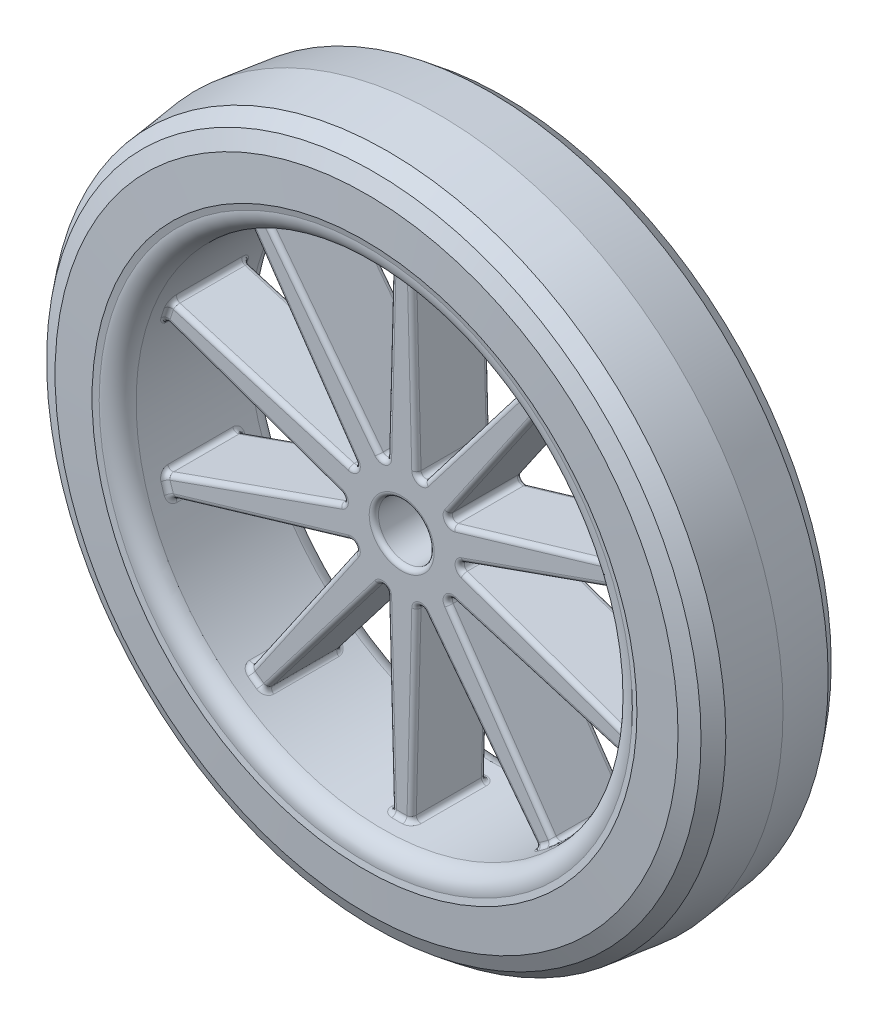
from build123d import *

# Parameters (mm, degrees)
BOSS_EXTRUDE4_DEPTH = 4
CIRPATTERN39_COUNT  = 10
FILLET4_R           = 0.5
SKETCH11_R          = 2.994477507
CUT_EXTRUDE1_DEPTH  = 10
FILLET3_R           = 0.5


# Read off the part's stored shape, not the designer's step: Revolve-Thin1
with BuildPart() as part:
    # Revolve-Thin1 outline → Revolve-Thin1 (revolve)
    with BuildSketch(Plane.XZ):
        with BuildLine():
            Line((26.5, -4.79589568), (26.5, -10.850265377))
            ThreePointArc((26.5, -10.850265377), (27.207907375, -12.198941087), (28.660266116, -12.657976066))
            Line((28.660266116, -12.657976066), (29.290683902, -12.79589568))
            ThreePointArc((29.290683902, -12.79589568), (29.151536285, -12.091168401), (28.575838837, -11.661546422))
            ThreePointArc((28.575838837, -11.661546422), (27.864520083, -11.444223367), (27.5, -10.79589568))
            Line((27.5, -10.79589568), (27.5, -4.79589568))
            Line((27.5, -4.79589568), (26.5, -4.79589568))
        make_face()
    revolve(axis=Axis((0, 0, 0), (0, 0, 1)))

    # Sketch9 → Boss-Extrude4 (add)
    with BuildSketch(Plane.XY.offset(-4.79589568)):
        Polygon((1.75, 0), (1.042980118, 27), (-1.042980118, 27), (-1.75, 0), align=None)
    extrude(amount=-BOSS_EXTRUDE4_DEPTH)

    # CirPattern39: part ×10 about axis
    cirpattern39_axis = Axis((0, 0, 0), (0, 0, 1))


with BuildPart() as part_1:
    add(part.part)
    for i in range(1, CIRPATTERN39_COUNT):
        add(part.part.rotate(cirpattern39_axis, i * 360 / CIRPATTERN39_COUNT))

    # Fillet4
    fillet4_edges = [part_1.edges().sort_by_distance(p)[0] for p in [
        (-4.239860712, 3.08043912, -6.79589568),
        (-5.240756055, 0, -6.79589568),
        (-4.239860712, -3.08043912, -6.79589568),
        (-1.619482684, -4.984255196, -6.79589568),
        (1.619482684, -4.984255196, -6.79589568),
        (4.239860712, -3.08043912, -6.79589568),
        (5.240756055, 0, -6.79589568),
        (4.239860712, 3.08043912, -6.79589568),
        (-1.619482684, 4.984255196, -6.79589568),
        (1.619482684, 4.984255196, -6.79589568),
    ]]
    fillet(fillet4_edges, radius=FILLET4_R)

    # Mirror4 2: part across plane


with BuildPart() as body_2:
    # Sketch10 → Revolve1 (revolve)
    with BuildSketch(Plane(origin=(0, 0, 0), x_dir=(0, 0, -1), z_dir=(1, 0, 0)), mode=Mode.PRIVATE) as revolve1_sk:
        Polygon((4.79589568, 27.5), (4.79589568, 37), (10.299774936, 36.34977124), (11.795301085, 35.179359471), (12.575575597, 33.488764695), (12.79589568, 29.290683902), align=None)
    revolve(revolve1_sk.sketch.rotate(Axis((0, 0, -25.261416216), (0, 0, 1)), 270), axis=Axis((0, 0, -25.261416216), (0, 0, 1)))

    # Mirror4: body 2 across plane


with BuildPart() as body_2_1:
    add(body_2.part)
    add(body_2.part.mirror(Plane(origin=(0, 27.5, -4.79589568), x_dir=(1, 0, 0), z_dir=(0, 0, -1))))


with BuildPart() as part_2:
    add(part_1.part)
    add(part_1.part.mirror(Plane(origin=(0, 27.5, -4.79589568), x_dir=(1, 0, 0), z_dir=(0, 0, -1))))

    # Sketch11 → Cut-Extrude1 (cut)
    with BuildSketch(Plane(origin=(0, 0, -8.79589568), x_dir=(-1, 0, 0), z_dir=(0, 0, -1))):
        Circle(SKETCH11_R)
    extrude(amount=-CUT_EXTRUDE1_DEPTH, mode=Mode.SUBTRACT)

    # Fillet3
    fillet3_edges = [part_2.edges().sort_by_distance(p)[0] for p in [
        (14.709094931, 22.042969997, -2.79589568),
        (0, 26.5, -8.79589568),
        (-1.05662491, 26.47892641, -6.79589568),
        (1.05662491, 26.47892641, -2.79589568),
        (-1.319573442, 16.437327103, -8.79589568),
        (-8.594061119, 14.073702777, -8.79589568),
        (1.319573442, 16.437327103, -8.79589568),
        (10.729175798, 12.52245116, -8.79589568),
        (16.040597671, 3.824424497, -8.79589568),
        (15.225056433, -6.334402337, -8.79589568),
        (8.594061119, -14.073702777, -8.79589568),
        (-1.319573442, -16.437327103, -8.79589568),
        (-10.729175798, -12.52245116, -8.79589568),
        (-16.040597671, -3.824424497, -8.79589568),
        (-15.225056433, 6.334402337, -8.79589568),
        (-1.927842139, 5.933288013, -8.79589568),
        (1.927842139, 5.933288013, -8.79589568),
        (5.047156244, 3.666973657, -8.79589568),
        (6.238628211, 0, -8.79589568),
        (5.047156244, -3.666973657, -8.79589568),
        (1.927842139, -5.933288013, -8.79589568),
        (-1.927842139, -5.933288013, -8.79589568),
        (-5.047156244, -3.666973657, -8.79589568),
        (-6.238628211, 0, -8.79589568),
        (-5.047156244, 3.666973657, -8.79589568),
        (0, 26.5, -0.79589568),
        (15.576309186, 21.438950351, -0.79589568),
        (25.202997682, 8.188950351, -0.79589568),
        (25.202997682, -8.188950351, -0.79589568),
        (15.576309186, -21.438950351, -0.79589568),
        (0, -26.5, -0.79589568),
        (-15.576309186, -21.438950351, -0.79589568),
        (-25.202997682, -8.188950351, -0.79589568),
        (-25.202997682, 8.188950351, -0.79589568),
        (-15.576309186, 21.438950351, -0.79589568),
        (1.319573442, 16.437327103, -0.79589568),
        (-1.319573442, 16.437327103, -0.79589568),
        (-8.594061119, 14.073702777, -0.79589568),
        (-10.729175798, 12.52245116, -0.79589568),
        (-15.225056433, 6.334402337, -0.79589568),
        (-16.040597671, 3.824424497, -0.79589568),
        (-16.040597671, -3.824424497, -0.79589568),
        (-15.225056433, -6.334402337, -0.79589568),
        (-10.729175798, -12.52245116, -0.79589568),
        (-8.594061119, -14.073702777, -0.79589568),
        (-1.319573442, -16.437327103, -0.79589568),
        (1.319573442, -16.437327103, -0.79589568),
        (8.594061119, -14.073702777, -0.79589568),
        (10.729175798, -12.52245116, -0.79589568),
        (15.225056433, -6.334402337, -0.79589568),
        (16.040597671, -3.824424497, -0.79589568),
        (16.040597671, 3.824424497, -0.79589568),
        (15.225056433, 6.334402337, -0.79589568),
        (10.729175798, 12.52245116, -0.79589568),
        (8.594061119, 14.073702777, -0.79589568),
        (-1.927842139, 5.933288013, -0.79589568),
        (1.927842139, 5.933288013, -0.79589568),
        (5.047156244, 3.666973657, -0.79589568),
        (6.238628211, 0, -0.79589568),
        (5.047156244, -3.666973657, -0.79589568),
        (1.927842139, -5.933288013, -0.79589568),
        (-1.927842139, -5.933288013, -0.79589568),
        (-5.047156244, -3.666973657, -0.79589568),
        (-6.238628211, 0, -0.79589568),
        (-5.047156244, 3.666973657, -0.79589568),
        (2.994477507, 0, -0.79589568),
        (2.994477507, 0, -8.79589568),
        (16.418749949, 20.800832919, -2.79589568),
        (24.856440452, 9.187348259, -2.79589568),
        (25.50947056, 7.177528248, -2.79589568),
        (25.50947056, -7.177528248, -2.79589568),
        (24.856440452, -9.187348259, -2.79589568),
        (16.418749949, -20.800832919, -2.79589568),
        (14.709094931, -22.042969997, -2.79589568),
        (1.05662491, -26.47892641, -2.79589568),
        (-1.05662491, -26.47892641, -2.79589568),
        (-14.709094931, -22.042969997, -2.79589568),
        (-16.418749949, -20.800832919, -2.79589568),
        (-24.856440452, -9.187348259, -2.79589568),
        (-25.50947056, -7.177528248, -2.79589568),
        (-25.50947056, 7.177528248, -2.79589568),
        (-24.856440452, 9.187348259, -2.79589568),
        (-16.418749949, 20.800832919, -2.79589568),
        (-10.729175798, 12.52245116, -8.79589568),
        (-16.040597671, 3.824424497, -8.79589568),
        (-15.225056433, -6.334402337, -8.79589568),
        (-8.594061119, -14.073702777, -8.79589568),
        (1.319573442, -16.437327103, -8.79589568),
        (10.729175798, -12.52245116, -8.79589568),
        (16.040597671, -3.824424497, -8.79589568),
        (15.225056433, 6.334402337, -8.79589568),
        (8.594061119, 14.073702777, -8.79589568),
        (25.202997682, -8.188950351, -8.79589568),
        (15.576309186, -21.438950351, -8.79589568),
        (0, -26.5, -8.79589568),
        (-15.576309186, -21.438950351, -8.79589568),
        (-25.202997682, -8.188950351, -8.79589568),
        (-25.202997682, 8.188950351, -8.79589568),
        (-15.576309186, 21.438950351, -8.79589568),
        (15.576309186, 21.438950351, -8.79589568),
        (25.202997682, 8.188950351, -8.79589568),
        (-14.709094931, 22.042969997, -2.79589568),
    ]]
    fillet(fillet3_edges, radius=FILLET3_R)


solid = Compound([body_2_1.part, part_2.part])
